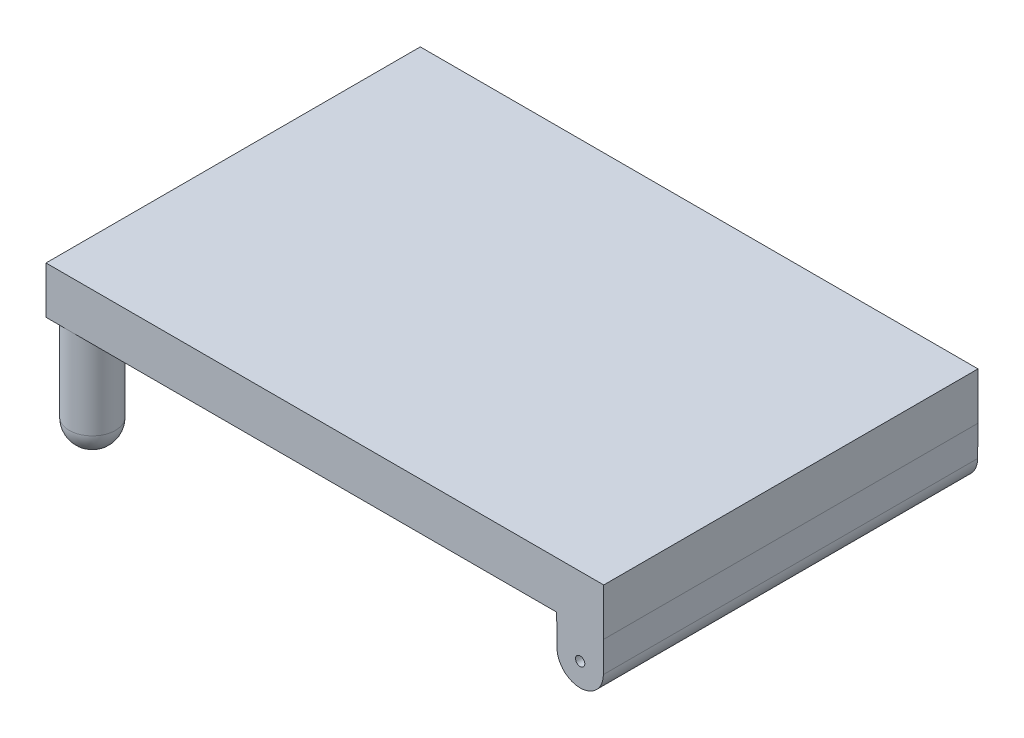
from build123d import *

# Parameters (mm, degrees)
SKETCH1_W           = 301
SKETCH1_H           = 202
BOSS_EXTRUDE1_DEPTH = 60
CUT_EXTRUDE1_DEPTH  = 259.948353924
SKETCH5_R           = 12.5
BOSS_EXTRUDE2_DEPTH = 59.1
FILLET1_R           = 12.5
SKETCH2_R           = 2.5
CUT_EXTRUDE2_DEPTH  = 259.948353924


with BuildPart() as part:
    # Sketch1 → Boss-Extrude1 (new body)
    with BuildSketch(Plane(origin=(0, 0, 0), x_dir=(1, 0, 0), z_dir=(0, 1, 0))):
        Rectangle(SKETCH1_W, SKETCH1_H)
    extrude(amount=BOSS_EXTRUDE1_DEPTH)

    # Sketch4 → Cut-Extrude1 (cut, through all)
    with BuildSketch(Plane.XY.offset(101)):
        with BuildLine():
            Line((125.3, 18), (125.1, 34.6))
            Line((125.1, 34.6), (-150.5, 34.6))
            Line((-150.5, 34.6), (-150.5, 0))
            Line((-150.5, 0), (150.5, 0))
            Line((150.5, 0), (150.5, 34.6))
            Line((150.5, 34.6), (150.3, 18))
            ThreePointArc((150.3, 18), (137.8, 5.5), (125.3, 18))
        make_face()
    extrude(amount=-CUT_EXTRUDE1_DEPTH, mode=Mode.SUBTRACT)

    # Sketch5 → Boss-Extrude2 (add)
    with BuildSketch(Plane.XZ.offset(-34.6)):
        with Locations((-138, 88.5)):
            Circle(SKETCH5_R)
        with Locations((-138, -88.5)):
            Circle(SKETCH5_R)
    extrude(amount=BOSS_EXTRUDE2_DEPTH)

    # Fillet1
    fillet1_edges = [part.edges().sort_by_distance(p)[0] for p in [
        (-150.5, -24.5, -88.5),
        (-150.5, -24.5, 88.5),
    ]]
    fillet(fillet1_edges, radius=FILLET1_R)

    # Sketch2 → Cut-Extrude2 (cut, through all)
    with BuildSketch(Plane.XY.offset(101)):
        with Locations((137.8, 18)):
            Circle(SKETCH2_R)
    extrude(amount=-CUT_EXTRUDE2_DEPTH, mode=Mode.SUBTRACT)


solid = part.part
